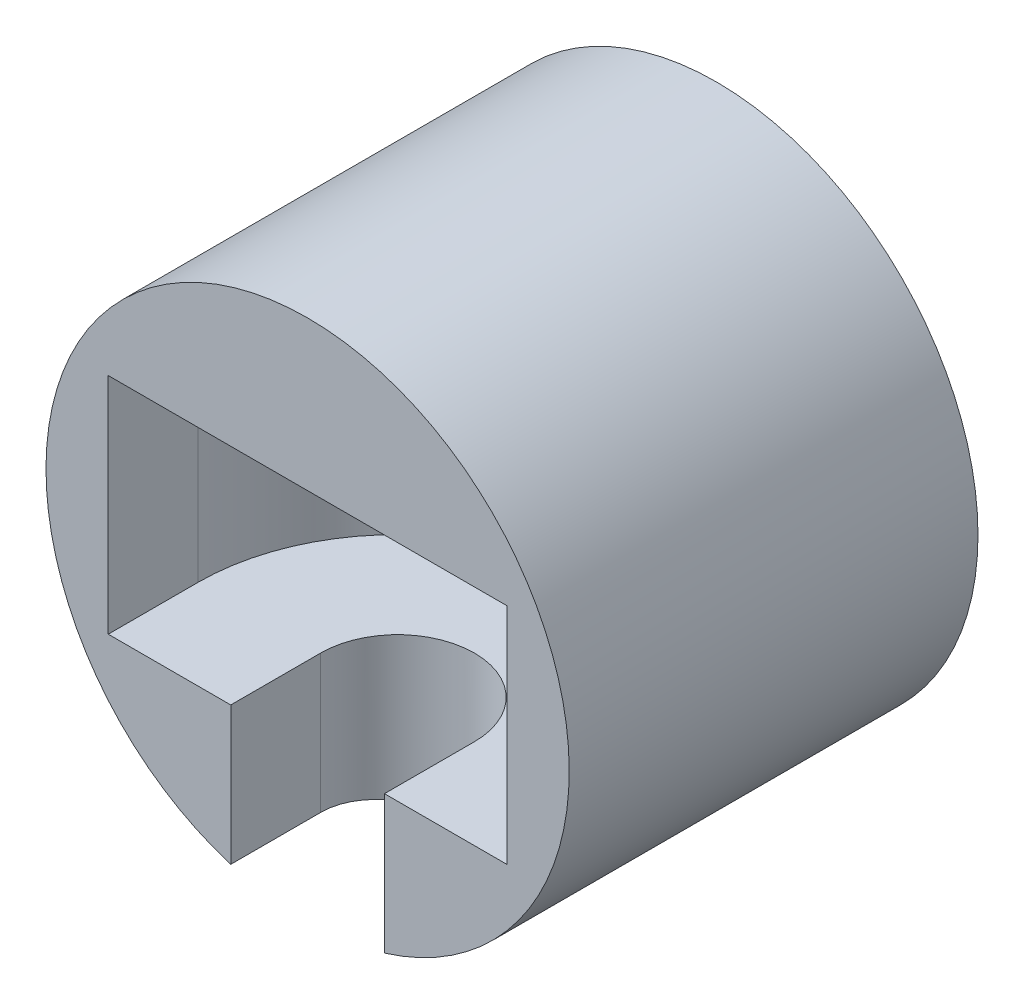
from build123d import *

# Parameters (mm, degrees)
SKETCH1_R               = 16
SKETCH1_R_2             = 3
BOSS_EXTRUDE1_DEPTH     = 25
CUT_EXTRUDE1_DEPTH      = 6.85
CUT_EXTRUDE2_REACH      = 35.719
CUT_EXTRUDE2_END_RADIUS = 16


with BuildPart() as part:
    # Sketch1 → Boss-Extrude1 (new body)
    with BuildSketch(Plane.XY):
        Circle(SKETCH1_R)
        Circle(SKETCH1_R_2, mode=Mode.SUBTRACT)
    extrude(amount=BOSS_EXTRUDE1_DEPTH)

    # Sketch2 → Cut-Extrude1 (cut, symmetric)
    with BuildSketch(Plane(origin=(0, 0, 0), x_dir=(1, 0, 0), z_dir=(0, 1, 0))):
        with BuildLine():
            Line((12.19297317, -25), (-12.19297317, -25))
            Line((-12.19297317, -25), (-12.19297317, -19.5))
            ThreePointArc((-12.19297317, -19.5), (-10.810418298, -13.860545155), (-6.976288033, -9.5))
            Line((-6.976288033, -9.5), (6.976288033, -9.5))
            ThreePointArc((6.976288033, -9.5), (10.810418298, -13.860545155), (12.19297317, -19.5))
            Line((12.19297317, -19.5), (12.19297317, -25))
        make_face()
    extrude(amount=CUT_EXTRUDE1_DEPTH, both=True, mode=Mode.SUBTRACT)

    # Cut-Extrude2: up to this cylinder (the profile starts inside it)
    cut_extrude2_end = Plane(origin=(0, 0, 20.344451), z_dir=(0, 0, -1)) * Cylinder(CUT_EXTRUDE2_END_RADIUS, 104.438, mode=Mode.PRIVATE)
    # Sketch3 → Cut-Extrude2 (cut, up to the surface)
    with BuildSketch(Plane(origin=(0, 0, 0), x_dir=(1, 0, 0), z_dir=(0, 1, 0)), mode=Mode.PRIVATE) as cut_extrude2_sk1:
        with BuildLine():
            Line((-4.7, -19.5), (-4.7, -25))
            Line((-4.7, -25), (4.7, -25))
            Line((4.7, -25), (4.7, -19.5))
            ThreePointArc((4.7, -19.5), (0, -14.8), (-4.7, -19.5))
        make_face()
    cut_extrude2_tool1 = extrude(cut_extrude2_sk1.sketch, amount=-CUT_EXTRUDE2_REACH, mode=Mode.PRIVATE) & cut_extrude2_end
    add(cut_extrude2_tool1.solids().sort_by_distance((0, 0, 20.344451))[0], mode=Mode.SUBTRACT)


solid = part.part
